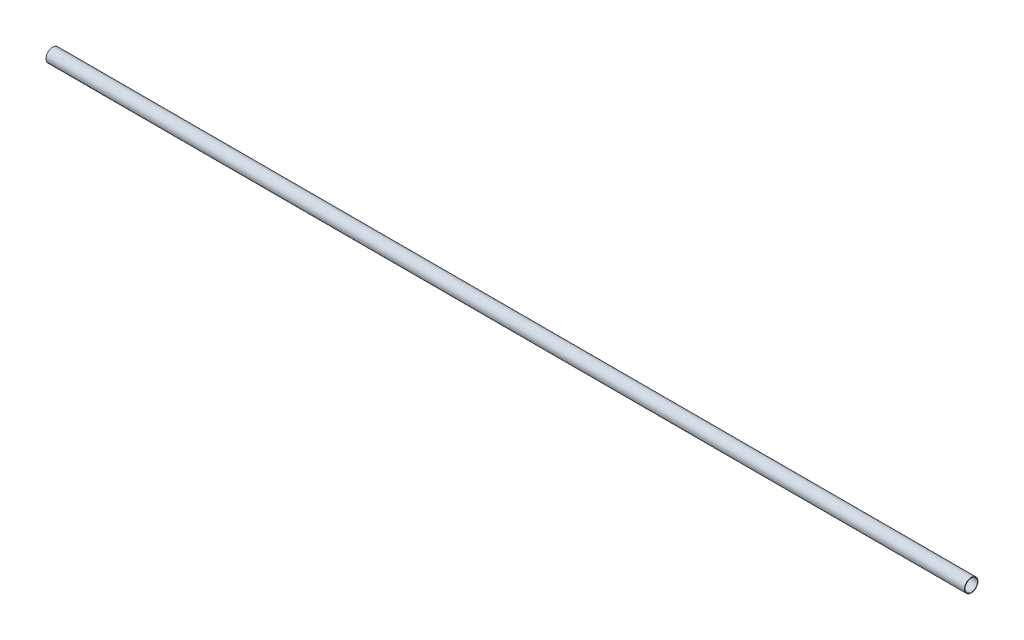
from build123d import *

# Parameters (mm, degrees)
SKETCH1_R           = 12.5
SKETCH1_R_2         = 11.5
BOSS_EXTRUDE1_DEPTH = 1700


with BuildPart() as part:
    # Sketch1 → Boss-Extrude1 (new body)
    with BuildSketch(Plane(origin=(0, 0, 0), x_dir=(0, 0, -1), z_dir=(1, 0, 0))):
        Circle(SKETCH1_R)
        Circle(SKETCH1_R_2, mode=Mode.SUBTRACT)
    extrude(amount=BOSS_EXTRUDE1_DEPTH)


solid = part.part
